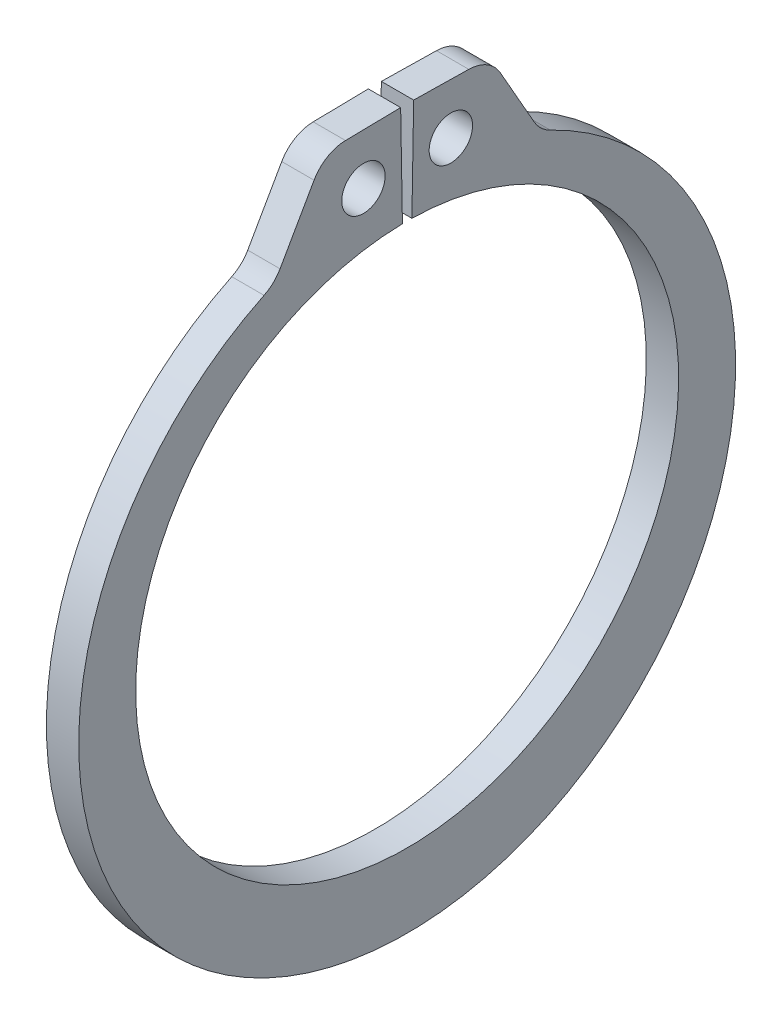
from build123d import *

# Parameters (mm, degrees)
SKETCH1_R      = 0.5969
EXTRUDE1_DEPTH = 0.4445
FILLET1_R      = 1.016


with BuildPart() as part:
    # Sketch1 → Extrude1 (new, symmetric)
    with BuildSketch(Plane(origin=(0, 0, 0), x_dir=(0, 0, -1), z_dir=(1, 0, 0))):
        with BuildLine():
            Line((-0.13032759, 7.466462648), (-0.179089614, 10.260037109))
            Line((-0.179089614, 10.260037109), (-2.274270459, 10.223465591))
            Line((-2.274270459, 10.223465591), (-3.65683248, 7.795512079))
            ThreePointArc((-3.65683248, 7.795512079), (0, -9.4996), (3.65683248, 7.795512079))
            Line((3.65683248, 7.795512079), (2.274270459, 10.223465591))
            Line((2.274270459, 10.223465591), (0.179089614, 10.260037109))
            Line((0.179089614, 10.260037109), (0.13032759, 7.466462648))
            ThreePointArc((0.13032759, 7.466462648), (0, -7.4676), (-0.13032759, 7.466462648))
        make_face()
        with Locations((-1.202299025, 8.84496412)):
            Circle(SKETCH1_R, mode=Mode.SUBTRACT)
        with Locations((1.202299025, 8.84496412)):
            Circle(SKETCH1_R, mode=Mode.SUBTRACT)
    extrude(amount=EXTRUDE1_DEPTH, both=True)

    # Fillet1
    fillet1_edges = [part.edges().sort_by_distance(p)[0] for p in [
        (0, 7.795512079, 3.65683248),
        (0, 7.795512079, -3.65683248),
        (0, 10.223465591, 2.274270459),
        (0, 10.223465591, -2.274270459),
    ]]
    fillet(fillet1_edges, radius=FILLET1_R)


solid = part.part
